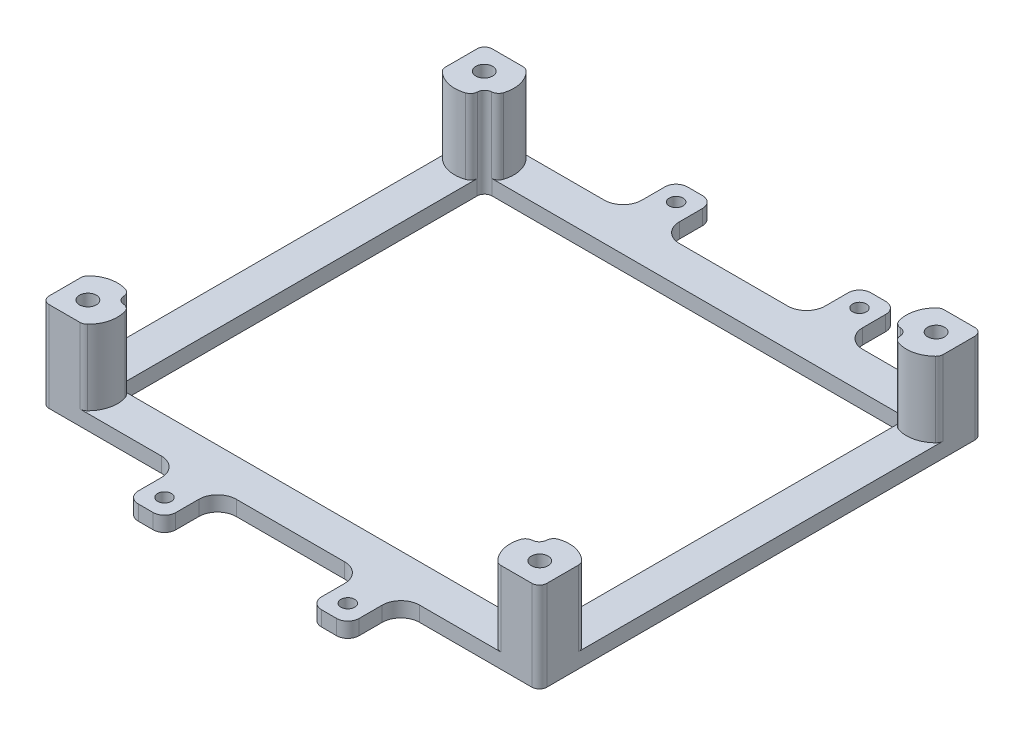
from build123d import *

# Parameters (mm, degrees)
SKETCH1_R           = 1.8415
SKETCH1_W           = 132.75
SKETCH1_H           = 118.15
SKETCH1_R_2         = 2.25
SKETCH1_W_2         = 112.75
SKETCH1_H_2         = 98.15
BOSS_EXTRUDE3_DEPTH = 4
FILLET1_R           = 2
FILLET2_R           = 3
BOSS_EXTRUDE5_START = 20
SKETCH3_R           = 2.25
BOSS_EXTRUDE5_DEPTH = 20
FILLET3_R           = 2


with BuildPart() as part:
    # Sketch1 → Boss-Extrude3 (new body)
    # profile 1 of 13: a face of its own
    with BuildSketch(Plane(origin=(0, 0, 0), x_dir=(1, 0, 0), z_dir=(0, 1, 0))):
        Polygon((-29.4475, 64.075), (-29.4475, 59.075), (-19.4475, 59.075), (-19.4475, 64.075), (-19.4475, 73.2244), (-29.4475, 73.2244), align=None)
        with Locations(Location((-24.4475, 68.2244, 0), (0, 0, 270))):
            Circle(SKETCH1_R, mode=Mode.SUBTRACT)
    # profile 2 of 13: a face of its own
    with BuildSketch(Plane(origin=(0, 0, 0), x_dir=(1, 0, 0), z_dir=(0, 1, 0))):
        Polygon((19.4475, 64.075), (19.4475, 59.075), (29.4475, 59.075), (29.4475, 64.075), (29.4475, 73.2244), (19.4475, 73.2244), align=None)
        with Locations(Location((24.4475, 68.2244, 0), (0, 0, 270))):
            Circle(SKETCH1_R, mode=Mode.SUBTRACT)
    # profile 3 of 13: a face of its own
    with BuildSketch(Plane(origin=(0, 0, 0), x_dir=(1, 0, 0), z_dir=(0, 1, 0))):
        Rectangle(SKETCH1_W, SKETCH1_H)
        with Locations(Location((60.25, -52.85, 0), (0, 0, 270))):
            Circle(SKETCH1_R_2, mode=Mode.SUBTRACT)
        with Locations(Location((-60.25, -52.85, 0), (0, 0, 270))):
            Circle(SKETCH1_R_2, mode=Mode.SUBTRACT)
        with Locations(Location((60.25, 52.85, 0), (0, 0, 270))):
            Circle(SKETCH1_R_2, mode=Mode.SUBTRACT)
        with Locations(Location((-60.25, 52.85, 0), (0, 0, 270))):
            Circle(SKETCH1_R_2, mode=Mode.SUBTRACT)
        Rectangle(SKETCH1_W_2, SKETCH1_H_2, mode=Mode.SUBTRACT)
    # profile 4 of 13: a face of its own
    with BuildSketch(Plane(origin=(0, 0, 0), x_dir=(1, 0, 0), z_dir=(0, 1, 0))):
        Polygon((-19.4475, -59.075), (-29.4475, -59.075), (-29.4475, -64.075), (-29.4475, -73.2244), (-19.4475, -73.2244), (-19.4475, -64.075), align=None)
        with Locations(Location((-24.4475, -68.2244, 0), (0, 0, 270))):
            Circle(SKETCH1_R, mode=Mode.SUBTRACT)
    # profile 5 of 13: a face of its own
    with BuildSketch(Plane(origin=(0, 0, 0), x_dir=(1, 0, 0), z_dir=(0, 1, 0))):
        Polygon((29.4475, -59.075), (19.4475, -59.075), (19.4475, -64.075), (19.4475, -73.2244), (29.4475, -73.2244), (29.4475, -64.075), align=None)
        with Locations(Location((24.4475, -68.2244, 0), (0, 0, 270))):
            Circle(SKETCH1_R, mode=Mode.SUBTRACT)
    # profile 6 of 13: a face of its own
    with BuildSketch(Plane(origin=(0, 0, 0), x_dir=(1, 0, 0), z_dir=(0, 1, 0))):
        with BuildLine():
            ThreePointArc((19.4475, 64.075), (17.983033906, 60.539466094), (14.4475, 59.075))
            Line((14.4475, 59.075), (19.4475, 59.075))
            Line((19.4475, 59.075), (19.4475, 64.075))
        make_face()
    # profile 7 of 13: a face of its own
    with BuildSketch(Plane(origin=(0, 0, 0), x_dir=(1, 0, 0), z_dir=(0, 1, 0))):
        with BuildLine():
            Line((29.4475, 64.075), (29.4475, 59.075))
            Line((29.4475, 59.075), (34.4475, 59.075))
            ThreePointArc((34.4475, 59.075), (30.911966094, 60.539466094), (29.4475, 64.075))
        make_face()
    # profile 8 of 13: a face of its own
    with BuildSketch(Plane(origin=(0, 0, 0), x_dir=(1, 0, 0), z_dir=(0, 1, 0))):
        with BuildLine():
            ThreePointArc((-29.4475, 64.075), (-30.911966094, 60.539466094), (-34.4475, 59.075))
            Line((-34.4475, 59.075), (-29.4475, 59.075))
            Line((-29.4475, 59.075), (-29.4475, 64.075))
        make_face()
    # profile 9 of 13: a face of its own
    with BuildSketch(Plane(origin=(0, 0, 0), x_dir=(1, 0, 0), z_dir=(0, 1, 0))):
        with BuildLine():
            Line((-19.4475, 64.075), (-19.4475, 59.075))
            Line((-19.4475, 59.075), (-14.4475, 59.075))
            ThreePointArc((-14.4475, 59.075), (-17.983033906, 60.539466094), (-19.4475, 64.075))
        make_face()
    # profile 10 of 13: a face of its own
    with BuildSketch(Plane(origin=(0, 0, 0), x_dir=(1, 0, 0), z_dir=(0, 1, 0))):
        with BuildLine():
            Line((-14.4475, -59.075), (-19.4475, -59.075))
            Line((-19.4475, -59.075), (-19.4475, -64.075))
            ThreePointArc((-19.4475, -64.075), (-17.983033906, -60.539466094), (-14.4475, -59.075))
        make_face()
    # profile 11 of 13: a face of its own
    with BuildSketch(Plane(origin=(0, 0, 0), x_dir=(1, 0, 0), z_dir=(0, 1, 0))):
        with BuildLine():
            Line((-29.4475, -59.075), (-34.4475, -59.075))
            ThreePointArc((-34.4475, -59.075), (-30.911966094, -60.539466094), (-29.4475, -64.075))
            Line((-29.4475, -64.075), (-29.4475, -59.075))
        make_face()
    # profile 12 of 13: a face of its own
    with BuildSketch(Plane(origin=(0, 0, 0), x_dir=(1, 0, 0), z_dir=(0, 1, 0))):
        with BuildLine():
            Line((19.4475, -59.075), (14.4475, -59.075))
            ThreePointArc((14.4475, -59.075), (17.983033906, -60.539466094), (19.4475, -64.075))
            Line((19.4475, -64.075), (19.4475, -59.075))
        make_face()
    # profile 13 of 13: a face of its own
    with BuildSketch(Plane(origin=(0, 0, 0), x_dir=(1, 0, 0), z_dir=(0, 1, 0))):
        with BuildLine():
            Line((34.4475, -59.075), (29.4475, -59.075))
            Line((29.4475, -59.075), (29.4475, -64.075))
            ThreePointArc((29.4475, -64.075), (30.911966094, -60.539466094), (34.4475, -59.075))
        make_face()
    extrude(amount=BOSS_EXTRUDE3_DEPTH)

    # Fillet1
    fillet1_edges = [part.edges().sort_by_distance(p)[0] for p in [
        (56.375, 2, -49.075),
        (-56.375, 2, -49.075),
        (-56.375, 2, 49.075),
        (56.375, 2, 49.075),
        (-66.375, 2, 59.075),
        (-66.375, 2, -59.075),
        (66.375, 2, -59.075),
        (66.375, 2, 59.075),
    ]]
    fillet(fillet1_edges, radius=FILLET1_R)

    # Fillet2
    fillet2_edges = [part.edges().sort_by_distance(p)[0] for p in [
        (29.4475, 2, 73.2244),
        (19.4475, 2, 73.2244),
        (-19.4475, 2, 73.2244),
        (-29.4475, 2, 73.2244),
        (-29.4475, 2, -73.2244),
        (-19.4475, 2, -73.2244),
        (19.4475, 2, -73.2244),
        (29.4475, 2, -73.2244),
    ]]
    fillet(fillet2_edges, radius=FILLET2_R)

    # Sketch3 → Boss-Extrude5 (add)
    # profile 1 of 4: a face of its own
    with BuildSketch(Plane(origin=(0, 4, 0), x_dir=(1, 0, 0), z_dir=(0, 1, 0)).offset(BOSS_EXTRUDE5_START)):
        with BuildLine():
            Line((-66.375, 47.850438753), (-66.375, 57.075))
            ThreePointArc((-66.375, 57.075), (-65.789213562, 58.489213562), (-64.375, 59.075))
            Line((-64.375, 59.075), (-55.375514113, 59.075))
            ThreePointArc((-55.375514113, 59.075), (-52.508114014, 54.454505857), (-53.303014131, 49.075))
            Line((-53.303014131, 49.075), (-54.375, 49.075))
            ThreePointArc((-54.375, 49.075), (-55.789213562, 48.489213562), (-56.375, 47.075))
            Line((-56.375, 47.075), (-56.375, 45.958293922))
            ThreePointArc((-56.375, 45.958293922), (-61.719924493, 45.081437736), (-66.375, 47.850438753))
        make_face()
        with Locations(Location((-60.25, 52.85, 0), (0, 0, 270))):
            Circle(SKETCH3_R, mode=Mode.SUBTRACT)
    # profile 2 of 4: a face of its own
    with BuildSketch(Plane(origin=(0, 4, 0), x_dir=(1, 0, 0), z_dir=(0, 1, 0)).offset(BOSS_EXTRUDE5_START)):
        with BuildLine():
            Line((56.375, 47.075), (56.375, 45.958293922))
            ThreePointArc((56.375, 45.958293922), (61.719924493, 45.081437736), (66.375, 47.850438753))
            Line((66.375, 47.850438753), (66.375, 57.075))
            ThreePointArc((66.375, 57.075), (65.789213562, 58.489213562), (64.375, 59.075))
            Line((64.375, 59.075), (55.375514113, 59.075))
            ThreePointArc((55.375514113, 59.075), (52.508114014, 54.454505857), (53.303014131, 49.075))
            Line((53.303014131, 49.075), (54.375, 49.075))
            ThreePointArc((54.375, 49.075), (55.789213562, 48.489213562), (56.375, 47.075))
        make_face()
        with Locations(Location((60.25, 52.85, 0), (0, 0, 90))):
            Circle(SKETCH3_R, mode=Mode.SUBTRACT)
    # profile 3 of 4: a face of its own
    with BuildSketch(Plane(origin=(0, 4, 0), x_dir=(1, 0, 0), z_dir=(0, 1, 0)).offset(BOSS_EXTRUDE5_START)):
        with BuildLine():
            Line((66.375, -47.850438753), (66.375, -57.075))
            ThreePointArc((66.375, -57.075), (65.789213562, -58.489213562), (64.375, -59.075))
            Line((64.375, -59.075), (55.375514113, -59.075))
            ThreePointArc((55.375514113, -59.075), (52.508114014, -54.454505857), (53.303014131, -49.075))
            Line((53.303014131, -49.075), (54.375, -49.075))
            ThreePointArc((54.375, -49.075), (55.789213562, -48.489213562), (56.375, -47.075))
            Line((56.375, -47.075), (56.375, -45.958293922))
            ThreePointArc((56.375, -45.958293922), (61.719924493, -45.081437736), (66.375, -47.850438753))
        make_face()
        with Locations(Location((60.25, -52.85, 0), (0, 0, 270))):
            Circle(SKETCH3_R, mode=Mode.SUBTRACT)
    # profile 4 of 4: a face of its own
    with BuildSketch(Plane(origin=(0, 4, 0), x_dir=(1, 0, 0), z_dir=(0, 1, 0)).offset(BOSS_EXTRUDE5_START)):
        with BuildLine():
            Line((-56.375, -47.075), (-56.375, -45.958293922))
            ThreePointArc((-56.375, -45.958293922), (-61.719924493, -45.081437736), (-66.375, -47.850438753))
            Line((-66.375, -47.850438753), (-66.375, -57.075))
            ThreePointArc((-66.375, -57.075), (-65.789213562, -58.489213562), (-64.375, -59.075))
            Line((-64.375, -59.075), (-55.375514113, -59.075))
            ThreePointArc((-55.375514113, -59.075), (-52.508114014, -54.454505857), (-53.303014131, -49.075))
            Line((-53.303014131, -49.075), (-54.375, -49.075))
            ThreePointArc((-54.375, -49.075), (-55.789213562, -48.489213562), (-56.375, -47.075))
        make_face()
        with Locations(Location((-60.25, -52.85, 0), (0, 0, 90))):
            Circle(SKETCH3_R, mode=Mode.SUBTRACT)
    extrude(amount=-BOSS_EXTRUDE5_DEPTH)

    # Fillet3
    # the kernel refuses this fillet: 2 mm, written as the material it takes off along each edge
    with BuildSketch(Plane(origin=(-55.375514113, 26.161072157, 59.075), x_dir=(0.7524559247043358, 0, -0.6586426051944584), z_dir=(0, -1, 0)), Plane(origin=(55.375514113, 26.161072157, -59.075), x_dir=(-0.7524559247043358, 0, 0.6586426051944584), z_dir=(0, -1, 0))) as fillet3_piece_1:
        with BuildLine():
            CenterArc((0.755096128, -1.997009352), FILLET3_R, 86.866285745, 44.330146388)
            Line((-0.562189082, -0.492097503), (0, 0))
            ThreePointArc((0, 0), (0.432214431, 0.011822636), (0.864428863, 0))
        make_face()
    extrude(amount=22.161072157, mode=Mode.SUBTRACT)
    with BuildSketch(Plane(origin=(-53.303014131, 27.773536346, 49.075), x_dir=(-0.9999951371262895, 0, -0.003118609269165201), z_dir=(0, -1, 0))) as fillet3_piece_2:
        with BuildLine():
            CenterArc((1.309735319, -1.996647169), FILLET3_R, 93.318097492, 68.938549096)
            Line((-0.595126999, -1.38713954), (-0.78561323, -1.326188777))
            ThreePointArc((-0.78561323, -1.326188777), (-0.514540016, -0.600479941), (-0.175431931, 0.096039772))
            Line((-0.175431931, 0.096039772), (0.000623722, 0.199999027))
            ThreePointArc((0.000623722, 0.199999027), (1.072604378, 0.196655922), (1.182400725, 0.199664717))
            Line((1.182400725, 0.199664717), (1.193976597, 0))
        make_face()
    extrude(amount=23.773536346, mode=Mode.SUBTRACT)
    with BuildSketch(Plane(origin=(-56.375, 27.720113625, 45.958293922), x_dir=(-0.9139141920372147, 0, -0.4059074396866423), z_dir=(0, -1, 0)), Plane(origin=(56.375, 27.720113625, -45.958293922), x_dir=(0.9139141920372147, 0, 0.4059074396866423), z_dir=(0, -1, 0))) as fillet3_piece_3:
        with BuildLine():
            CenterArc((1.299837854, -1.991124783), FILLET3_R, 84.600259862, 68.938549096)
            Line((-0.490634918, -1.099941718), (-0.669682195, -1.010823412))
            ThreePointArc((-0.669682195, -1.010823412), (-0.636062143, -0.939392045), (-0.182782838, 0.081181488))
            Line((-0.182782838, 0.081181488), (-0.01882076, 0.199112478))
            ThreePointArc((-0.01882076, 0.199112478), (0.744022725, 0.23508553), (1.506866209, 0.199112478))
            Line((1.506866209, 0.199112478), (1.48804545, 0))
        make_face()
    extrude(amount=23.720113625, mode=Mode.SUBTRACT)
    with BuildSketch(Plane(origin=(-66.375, 26.233762317, 47.850438753), x_dir=(0.6751067692809941, 0, -0.7377200350207241), z_dir=(0, -1, 0)), Plane(origin=(66.375, 26.233762317, -47.850438753), x_dir=(-0.6751067692809941, 0, 0.7377200350207241), z_dir=(0, -1, 0))) as fillet3_piece_4:
        with BuildLine():
            CenterArc((0.780494659, 1.996804617), FILLET3_R, 227.537557999, 45.701672964)
            Line((-0.569718879, 0.521364547), (0, 0))
            ThreePointArc((0, 0), (0.446752463, -0.012631995), (0.893504927, 0))
        make_face()
    extrude(amount=22.233762317, mode=Mode.SUBTRACT)
    with BuildSketch(Plane(origin=(66.375, 26.233762317, 47.850438753), x_dir=(-0.6751067692809941, 0, -0.7377200350207241), z_dir=(0, -1, 0)), Plane(origin=(-66.375, 26.233762317, -47.850438753), x_dir=(0.6751067692809941, 0, 0.7377200350207241), z_dir=(0, -1, 0))) as fillet3_piece_5:
        with BuildLine():
            CenterArc((0.780494659, -1.996804617), FILLET3_R, 86.760769036, 45.701672964)
            Line((-0.569718879, -0.521364547), (0, 0))
            ThreePointArc((0, 0), (0.446752463, 0.012631995), (0.893504927, 0))
        make_face()
    extrude(amount=22.233762317, mode=Mode.SUBTRACT)
    with BuildSketch(Plane(origin=(53.303014131, 27.773536346, 49.075), x_dir=(-0.3914088166660056, 0, 0.9202168973867614), z_dir=(0, -1, 0))) as fillet3_piece_6:
        with BuildLine():
            CenterArc((1.318504186, -1.990867458), FILLET3_R, 84.522481445, 68.938549096)
            Line((-0.470757165, -1.097254668), (-0.6496833, -1.007893389))
            ThreePointArc((-0.6496833, -1.007893389), (-0.6036281, -0.908177747), (-0.184043379, 0.078281763))
            Line((-0.184043379, 0.078281763), (-0.019091035, 0.199086746))
            ThreePointArc((-0.019091035, 0.199086746), (0.754707269, 0.236102785), (1.528505574, 0.199086746))
            Line((1.528505574, 0.199086746), (1.509414538, 0))
        make_face()
    extrude(amount=23.773536346, mode=Mode.SUBTRACT)
    with BuildSketch(Plane(origin=(56.375, 27.720113625, 45.958293922), x_dir=(0.9139141920372147, 0, -0.4059074396866423), z_dir=(0, -1, 0)), Plane(origin=(-56.375, 27.720113625, -45.958293922), x_dir=(-0.9139141920372147, 0, 0.4059074396866423), z_dir=(0, -1, 0))) as fillet3_piece_7:
        with BuildLine():
            CenterArc((1.299837854, 1.991124783), FILLET3_R, 206.461191041, 68.938549096)
            Line((-0.490634918, 1.099941718), (-0.669682195, 1.010823412))
            ThreePointArc((-0.669682195, 1.010823412), (-0.636062143, 0.939392045), (-0.182782838, -0.081181488))
            Line((-0.182782838, -0.081181488), (-0.01882076, -0.199112478))
            ThreePointArc((-0.01882076, -0.199112478), (0.744022725, -0.23508553), (1.506866209, -0.199112478))
            Line((1.506866209, -0.199112478), (1.48804545, 0))
        make_face()
    extrude(amount=23.720113625, mode=Mode.SUBTRACT)
    with BuildSketch(Plane(origin=(55.375514113, 26.161072157, 59.075), x_dir=(-0.7524559247043358, 0, -0.6586426051944584), z_dir=(0, -1, 0)), Plane(origin=(-55.375514113, 26.161072157, -59.075), x_dir=(0.7524559247043358, 0, 0.6586426051944584), z_dir=(0, -1, 0))) as fillet3_piece_8:
        with BuildLine():
            CenterArc((0.755096128, 1.997009352), FILLET3_R, 228.803567867, 44.330146388)
            Line((-0.562189082, 0.492097503), (0, 0))
            ThreePointArc((0, 0), (0.432214431, -0.011822636), (0.864428863, 0))
        make_face()
    extrude(amount=22.161072157, mode=Mode.SUBTRACT)
    with BuildSketch(Plane(origin=(-53.303014131, 27.773536346, -49.075), x_dir=(-0.9999951371262895, 0, 0.003118609269165201), z_dir=(0, -1, 0))) as fillet3_piece_9:
        with BuildLine():
            CenterArc((1.309735319, 1.996647169), FILLET3_R, 197.743353412, 68.938549096)
            Line((-0.595126999, 1.38713954), (-0.78561323, 1.326188777))
            ThreePointArc((-0.78561323, 1.326188777), (-0.514540016, 0.600479941), (-0.175431931, -0.096039772))
            Line((-0.175431931, -0.096039772), (0.000623722, -0.199999027))
            ThreePointArc((0.000623722, -0.199999027), (1.072604378, -0.196655922), (1.182400725, -0.199664717))
            Line((1.182400725, -0.199664717), (1.193976597, 0))
        make_face()
    extrude(amount=23.773536346, mode=Mode.SUBTRACT)
    with BuildSketch(Plane(origin=(53.303014131, 27.773536346, -49.075), x_dir=(-0.3914088166660056, 0, -0.9202168973867614), z_dir=(0, -1, 0))) as fillet3_piece_10:
        with BuildLine():
            CenterArc((1.318504186, 1.990867458), FILLET3_R, 206.538969459, 68.938549096)
            Line((-0.470757165, 1.097254668), (-0.6496833, 1.007893389))
            ThreePointArc((-0.6496833, 1.007893389), (-0.6036281, 0.908177747), (-0.184043379, -0.078281763))
            Line((-0.184043379, -0.078281763), (-0.019091035, -0.199086746))
            ThreePointArc((-0.019091035, -0.199086746), (0.754707269, -0.236102785), (1.528505574, -0.199086746))
            Line((1.528505574, -0.199086746), (1.509414538, 0))
        make_face()
    extrude(amount=23.773536346, mode=Mode.SUBTRACT)


solid = part.part
